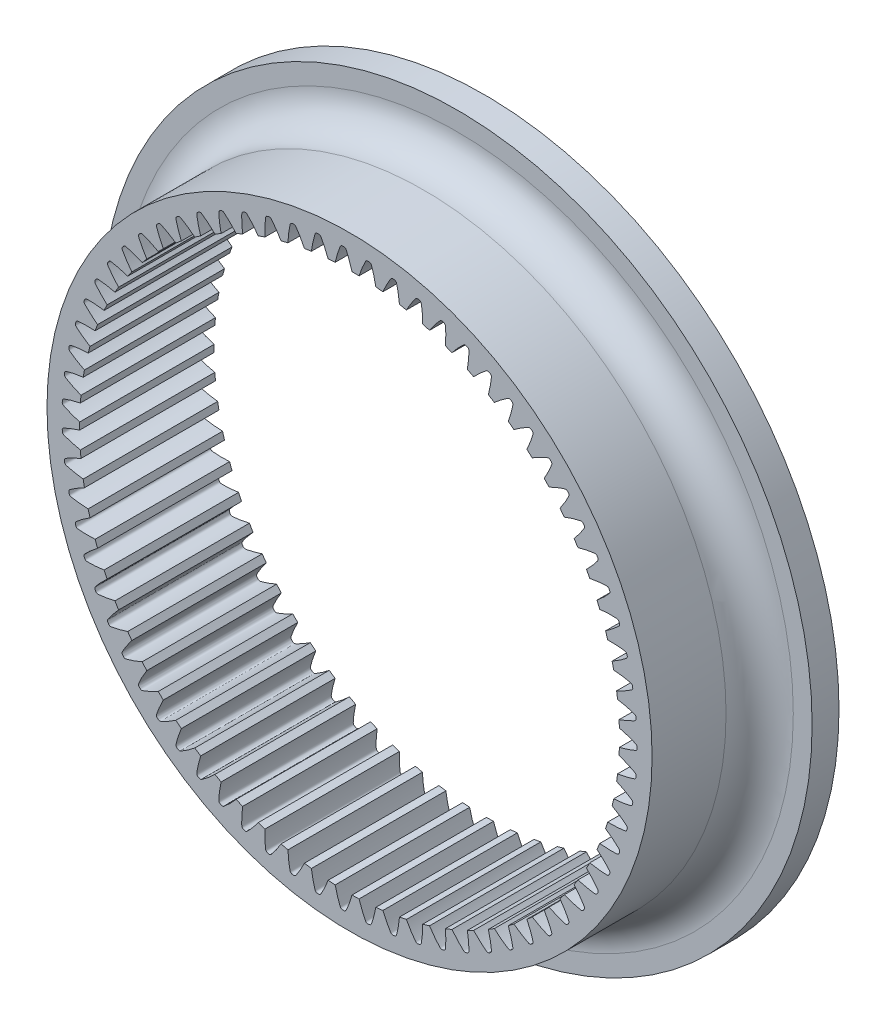
from build123d import *

# Parameters (mm, degrees)
SKETCHREVOLVERING_GEAR_FOLLOWER02_W       = 12.7
SKETCHREVOLVERING_GEAR_FOLLOWER02_H       = 12.605485554
TOOTHEXTRUDECUTRING_GEAR_FOLLOWER02_DEPTH = 6.35
PATTERNRING_GEAR_FOLLOWER02_COUNT         = 71
CUT_EXTRUDE1_START                        = -10.16
SKETCH1_R                                 = 38.1
SKETCH1_R_2                               = 28.575
CUT_EXTRUDE1_DEPTH                        = 10.16
SKETCH2_R                                 = 38.1
SKETCH2_R_2                               = 33.528
CUT_EXTRUDE2_DEPTH                        = 55.831064346


with BuildPart() as part:
    # SketchRevolveRing_Gear_Follower02 → Ring_Gear_Follower02 (revolve)
    with BuildSketch(Plane(origin=(0, 0, 0), x_dir=(0, 0, -1), z_dir=(1, 0, 0))):
        with Locations((0, 31.797257223)):
            Rectangle(SKETCHREVOLVERING_GEAR_FOLLOWER02_W, SKETCHREVOLVERING_GEAR_FOLLOWER02_H)
    revolve(axis=Axis((0, 0, 0), (0, 0, -1)))

    # SketchToothRing_Gear_Follower02 → ToothExtrudeCutRing_Gear_Follower02 (cut, symmetric)
    with BuildSketch(Plane.XY):
        with BuildLine():
            ThreePointArc((25.322927659, -0.82871153), (25.336484129, 0), (25.322927659, 0.82871153))
            add(Edge.make_bspline(
                [(25.322927659, 0.82871153), (25.411193227, 0.810779418), (25.548369787, 0.779641293), (25.73703866, 0.730716025), (25.893719775, 0.686526963), (26.060019661, 0.635793622), (26.235740614, 0.578122954), (26.420601194, 0.512958361), (26.614590985, 0.440440956), (26.816534891, 0.357921841), (26.965603298, 0.299305132), (27.053707916, 0.255658194), (27.07978715, 0.236202557), (27.102676224, 0.213703355), (27.122058774, 0.188078342), (27.137518064, 0.159938095), (27.152567702, 0.120273485), (27.157865815, 0.077173665), (27.157027264, 0.033782392), (27.157286624, 0), (27.157027264, -0.033782392), (27.157865815, -0.077173665), (27.152567702, -0.120273485), (27.137518064, -0.159938095), (27.122058774, -0.188078342), (27.102676224, -0.213703355), (27.07978715, -0.236202557), (27.053707916, -0.255658194), (26.965603298, -0.299305132), (26.816534891, -0.357921841), (26.614590985, -0.440440956), (26.420601194, -0.512958361), (26.235740614, -0.578122954), (26.060019661, -0.635793622), (25.893719775, -0.686526963), (25.73703866, -0.730716025), (25.548369787, -0.779641293), (25.411193227, -0.810779418), (25.322927659, -0.82871153)],
                knots=[0, 0, 0, 0, 0.063805266, 0.099630163, 0.138069903, 0.179124486, 0.222793912, 0.269078181, 0.317977293, 0.369491248, 0.423620045, 0.431437983, 0.438996188, 0.446554392, 0.454112596, 0.4616708, 0.469229004, 0.484048205, 0.492024109, 0.5, 0.507975891, 0.515951795, 0.530770996, 0.5383292, 0.545887404, 0.553445608, 0.561003812, 0.568562017, 0.576379955, 0.630508752, 0.682022707, 0.730921819, 0.777206088, 0.820875514, 0.861930097, 0.900369837, 0.936194734, 1, 1, 1, 1], degree=3))
        make_face()
    toothextrudecutring_gear_follower02 = extrude(amount=TOOTHEXTRUDECUTRING_GEAR_FOLLOWER02_DEPTH, both=True, mode=Mode.SUBTRACT)

    # PatternRing_Gear_Follower02: ToothExtrudeCutRing_Gear_Follower02 ×71 about axis
    patternring_gear_follower02_axis = Axis((0, 0, 6.985), (0, 0, -1))
    for i in range(1, PATTERNRING_GEAR_FOLLOWER02_COUNT):
        add(toothextrudecutring_gear_follower02.rotate(patternring_gear_follower02_axis, i * 360 / PATTERNRING_GEAR_FOLLOWER02_COUNT), mode=Mode.SUBTRACT)

    # Sketch1 → Cut-Extrude1 (cut)
    with BuildSketch(Plane.XY.offset(6.35).offset(CUT_EXTRUDE1_START)):
        Circle(SKETCH1_R)
        Circle(SKETCH1_R_2, mode=Mode.SUBTRACT)
    extrude(amount=CUT_EXTRUDE1_DEPTH, mode=Mode.SUBTRACT)

    # Sketch2 → Cut-Extrude2 (cut, through all)
    with BuildSketch(Plane.XY.offset(-3.81)):
        Circle(SKETCH2_R)
        Circle(SKETCH2_R_2, mode=Mode.SUBTRACT)
    extrude(amount=-CUT_EXTRUDE2_DEPTH, mode=Mode.SUBTRACT)

    # Sketch3 → Revolve1 (revolve)
    with BuildSketch(Plane(origin=(0, 0, 0), x_dir=(0, 0, -1), z_dir=(1, 0, 0))):
        with BuildLine():
            Line((0.635, 28.575), (3.81, 28.575))
            Line((3.81, 28.575), (3.81, 31.75))
            ThreePointArc((3.81, 31.75), (2.88006403, 29.50493597), (0.635, 28.575))
        make_face()
    revolve(axis=Axis((0, 0, 6.985), (0, 0, -1)))


solid = part.part
